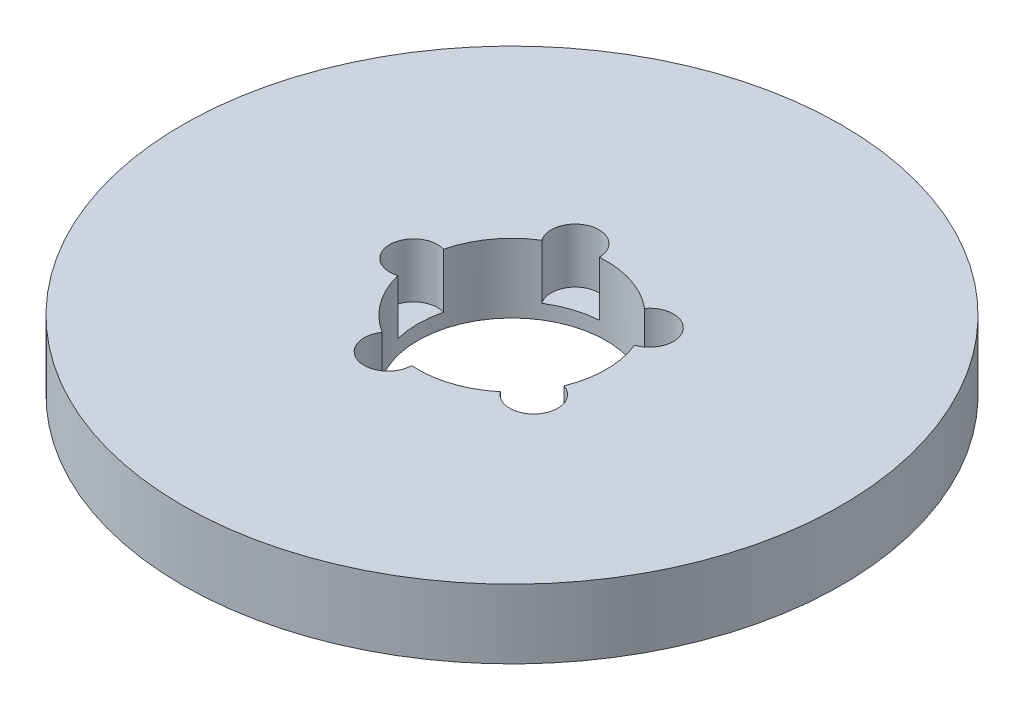
from build123d import *

# Parameters (mm, degrees)
SKETCH1_R           = 52.5
BOSS_EXTRUDE1_DEPTH = 11
SKETCH2_R           = 15
CUT_EXTRUDE1_DEPTH  = 76.056645275
SKETCH3_R           = 3.808658233
CUT_EXTRUDE2_DEPTH  = 8.697822275
CIRPATTERN1_COUNT   = 5


with BuildPart() as part:
    # Sketch1 → Boss-Extrude1 (new body)
    with BuildSketch(Plane(origin=(0, 0, 0), x_dir=(1, 0, 0), z_dir=(0, 1, 0))):
        Circle(SKETCH1_R)
    extrude(amount=BOSS_EXTRUDE1_DEPTH)

    # Sketch2 → Cut-Extrude1 (cut, through all)
    with BuildSketch(Plane(origin=(0, 0, 0), x_dir=(1, 0, 0), z_dir=(0, 1, 0))):
        Circle(SKETCH2_R)
    extrude(amount=CUT_EXTRUDE1_DEPTH, mode=Mode.SUBTRACT)

    # Sketch3 → Cut-Extrude2 (cut)
    with BuildSketch(Plane(origin=(0, 11, 0), x_dir=(1, 0, 0), z_dir=(0, 1, 0))):
        with Locations((-15.677679479, 0)):
            Circle(SKETCH3_R)
    cut_extrude2 = extrude(amount=-CUT_EXTRUDE2_DEPTH, mode=Mode.SUBTRACT)

    # CirPattern1: Cut-Extrude2 ×5 about axis
    cirpattern1_axis = Axis((0, 0, 0), (0, 1, 0))
    for i in range(1, CIRPATTERN1_COUNT):
        add(cut_extrude2.rotate(cirpattern1_axis, i * 360 / CIRPATTERN1_COUNT), mode=Mode.SUBTRACT)


solid = part.part
